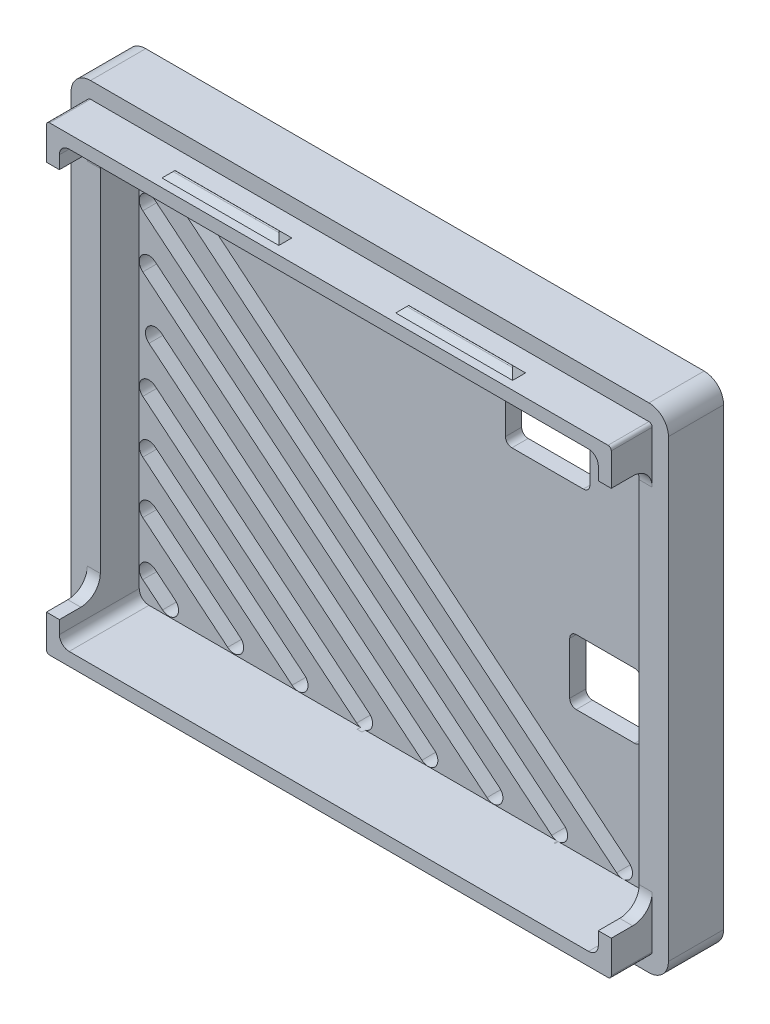
from build123d import *

# Parameters (mm, degrees)
EXTRUDE_1_DEPTH     = 2.5
EXTRUDE_6_DEPTH     = 6
EXTRUDE_7_DEPTH     = 12.3
SKETCH_7_W          = 20
SKETCH_7_H          = 4
EXTRUDE_8_DEPTH     = 1
CHAMFER_12_SIZE     = 2
CHAMFER_13_SIZE     = 2
FILLET_4_R          = 0.2
FILLET_5_R          = 0.2
MIRROR_START        = 8.886426593
MIRROR_1_OUTLINE_W  = 1
MIRROR_1_OUTLINE_H  = 4
MIRROR_1_DEPTH      = 20
MIRROR_START_2      = -26.113573407
MIRROR_1_2_DEPTH    = 18
MIRROR_START_3      = 11
MIRROR_1_3_DEPTH    = 3
CHAMFER_14_SIZE     = 2
FILLET_6_R          = 0.2
SKETCH_8_W          = 87
SKETCH_8_H          = 60
CUT_EXTRUDE_1_DEPTH = 6.3
FILLET_7_R          = 3
FILLET_8_R          = 3
FILLET_9_R          = 3
FILLET_10_R         = 3
CUT_EXTRUDE_2_DEPTH = 4
CUT_EXTRUDE_4_DEPTH = 6
CUT_EXTRUDE_5_DEPTH = 3


with BuildPart() as part:
    # 草图1 → 凸台-拉伸1 (new body)
    with BuildSketch(Plane.XY):
        with BuildLine():
            Line((-42.113573407, 33.400277008), (43.886426593, 33.400277008))
            ThreePointArc((43.886426593, 33.400277008), (46.007746936, 32.521597352), (46.886426593, 30.400277008))
            Line((46.886426593, 30.400277008), (46.886426593, -39.599722992))
            ThreePointArc((46.886426593, -39.599722992), (46.007746936, -41.721043335), (43.886426593, -42.599722992))
            Line((43.886426593, -42.599722992), (-42.113573407, -42.599722992))
            ThreePointArc((-42.113573407, -42.599722992), (-44.234893751, -41.721043335), (-45.113573407, -39.599722992))
            Line((-45.113573407, -39.599722992), (-45.113573407, 30.400277008))
            ThreePointArc((-45.113573407, 30.400277008), (-44.234893751, 32.521597352), (-42.113573407, 33.400277008))
        make_face()
    extrude(amount=EXTRUDE_1_DEPTH)

    # 草图2 → 凸台-拉伸6 (add)
    with BuildSketch(Plane.XY.offset(2.5)):
        with BuildLine():
            Line((-42.113573407, -42.599722992), (43.886426593, -42.599722992))
            ThreePointArc((43.886426593, -42.599722992), (46.007746936, -41.721043335), (46.886426593, -39.599722992))
            Line((46.886426593, -39.599722992), (46.886426593, 30.400277008))
            ThreePointArc((46.886426593, 30.400277008), (46.007746936, 32.521597352), (43.886426593, 33.400277008))
            Line((43.886426593, 33.400277008), (-42.113573407, 33.400277008))
            ThreePointArc((-42.113573407, 33.400277008), (-44.234893751, 32.521597352), (-45.113573407, 30.400277008))
            Line((-45.113573407, 30.400277008), (-45.113573407, -39.599722992))
            ThreePointArc((-45.113573407, -39.599722992), (-44.234893751, -41.721043335), (-42.113573407, -42.599722992))
        make_face()
        with BuildLine():
            Line((43.886426593, 30.900277008), (-42.113573407, 30.900277008))
            ThreePointArc((-42.113573407, 30.900277008), (-42.467126798, 30.753830399), (-42.613573407, 30.400277008))
            Line((-42.613573407, 30.400277008), (-42.613573407, -39.599722992))
            ThreePointArc((-42.613573407, -39.599722992), (-42.467126798, -39.953276382), (-42.113573407, -40.099722992))
            Line((-42.113573407, -40.099722992), (43.886426593, -40.099722992))
            ThreePointArc((43.886426593, -40.099722992), (44.239979983, -39.953276382), (44.386426593, -39.599722992))
            Line((44.386426593, -39.599722992), (44.386426593, 30.400277008))
            ThreePointArc((44.386426593, 30.400277008), (44.239979983, 30.753830399), (43.886426593, 30.900277008))
        make_face(mode=Mode.SUBTRACT)
    extrude(amount=EXTRUDE_6_DEPTH)

    # 草图6 → 凸台-拉伸7 (add)
    with BuildSketch(Plane.XY.offset(2.5)):
        with BuildLine():
            Line((44.386426593, -39.599722992), (44.386426593, 30.400277008))
            ThreePointArc((44.386426593, 30.400277008), (44.239979983, 30.753830399), (43.886426593, 30.900277008))
            Line((43.886426593, 30.900277008), (-42.113573407, 30.900277008))
            ThreePointArc((-42.113573407, 30.900277008), (-42.467126798, 30.753830399), (-42.613573407, 30.400277008))
            Line((-42.613573407, 30.400277008), (-42.613573407, -39.599722992))
            ThreePointArc((-42.613573407, -39.599722992), (-42.467126798, -39.953276382), (-42.113573407, -40.099722992))
            Line((-42.113573407, -40.099722992), (43.886426593, -40.099722992))
            ThreePointArc((43.886426593, -40.099722992), (44.239979983, -39.953276382), (44.386426593, -39.599722992))
        make_face()
        with BuildLine():
            Line((-40.613573407, 27.400277008), (-40.613573407, -36.599722992))
            ThreePointArc((-40.613573407, -36.599722992), (-40.174233579, -37.660383163), (-39.113573407, -38.099722992))
            Line((-39.113573407, -38.099722992), (40.886426593, -38.099722992))
            ThreePointArc((40.886426593, -38.099722992), (41.947086765, -37.660383163), (42.386426593, -36.599722992))
            Line((42.386426593, -36.599722992), (42.386426593, 27.400277008))
            ThreePointArc((42.386426593, 27.400277008), (41.947086765, 28.46093718), (40.886426593, 28.900277008))
            Line((40.886426593, 28.900277008), (-39.113573407, 28.900277008))
            ThreePointArc((-39.113573407, 28.900277008), (-40.174233579, 28.46093718), (-40.613573407, 27.400277008))
        make_face(mode=Mode.SUBTRACT)
    extrude(amount=EXTRUDE_7_DEPTH)

    # 草图7 → 凸台-拉伸8 (add)
    with BuildSketch(Plane.XZ.offset(40.099722992)):
        with Locations((-17.113573407, 12.5)):
            Rectangle(SKETCH_7_W, SKETCH_7_H)
        with Locations((18.886426593, 12.5)):
            Rectangle(SKETCH_7_W, SKETCH_7_H)
    extrude(amount=EXTRUDE_8_DEPTH)

    # 倒角12
    # the kernel refuses this chamfer: 2 mm, written as the material it takes off along each edge
    with BuildSketch(Plane(origin=(-32.256939383, -41.099722992, 14.5), x_dir=(0, 1, 0), z_dir=(1, 0, 0))) as chamfer_12_piece_1_section:
        Polygon((CHAMFER_12_SIZE, 0), (0, -CHAMFER_12_SIZE), (0, 0), align=None)
    chamfer_12_piece_1 = extrude(amount=30.286731952, mode=Mode.PRIVATE)
    chamfer_12_piece_1 = split(chamfer_12_piece_1, bisect_by=Plane(origin=(-32.256939383, -40.099722992, 14.5), z_dir=(0, -1, 0)), keep=Keep.TOP, mode=Mode.PRIVATE)
    add(chamfer_12_piece_1, mode=Mode.SUBTRACT)
    with BuildSketch(Plane(origin=(-7.113573407, -41.099722992, 19.643365976), x_dir=(0, 1, 0), z_dir=(0, 0, -1))) as chamfer_12_piece_2_section:
        Polygon((CHAMFER_12_SIZE, 0), (0, -CHAMFER_12_SIZE), (0, 0), align=None)
    chamfer_12_piece_2 = extrude(amount=9.143365976, mode=Mode.PRIVATE)
    chamfer_12_piece_2 = split(chamfer_12_piece_2, bisect_by=Plane(origin=(-7.113573407, -40.099722992, 19.643365976), z_dir=(0, -1, 0)), keep=Keep.TOP, mode=Mode.PRIVATE)
    add(chamfer_12_piece_2, mode=Mode.SUBTRACT)
    with BuildSketch(Plane(origin=(-1.970207431, -41.099722992, 10.5), x_dir=(0, 1, 0), z_dir=(-1, 0, 0))) as chamfer_12_piece_3_section:
        Polygon((CHAMFER_12_SIZE, 0), (0, -CHAMFER_12_SIZE), (0, 0), align=None)
    chamfer_12_piece_3 = extrude(amount=30.286731952, mode=Mode.PRIVATE)
    chamfer_12_piece_3 = split(chamfer_12_piece_3, bisect_by=Plane(origin=(-1.970207431, -40.099722992, 10.5), z_dir=(0, -1, 0)), keep=Keep.TOP, mode=Mode.PRIVATE)
    add(chamfer_12_piece_3, mode=Mode.SUBTRACT)
    with BuildSketch(Plane(origin=(-27.113573407, -41.099722992, 10.5), x_dir=(0, 1, 0), z_dir=(0, 0, 1))) as chamfer_12_piece_4_section:
        Polygon((CHAMFER_12_SIZE, 0), (0, -CHAMFER_12_SIZE), (0, 0), align=None)
    chamfer_12_piece_4 = extrude(amount=9.143365976, mode=Mode.PRIVATE)
    chamfer_12_piece_4 = split(chamfer_12_piece_4, bisect_by=Plane(origin=(-27.113573407, -40.099722992, 10.5), z_dir=(0, -1, 0)), keep=Keep.TOP, mode=Mode.PRIVATE)
    add(chamfer_12_piece_4, mode=Mode.SUBTRACT)

    # 倒角13
    # the kernel refuses this chamfer: 2 mm, written as the material it takes off along each edge
    with BuildSketch(Plane(origin=(3.743060617, -41.099722992, 14.5), x_dir=(0, 0, -1), z_dir=(1, 0, 0))) as chamfer_13_piece_1_section:
        Polygon((CHAMFER_13_SIZE, 0), (0, CHAMFER_13_SIZE), (0, 0), align=None)
    chamfer_13_piece_1 = extrude(amount=30.286731952, mode=Mode.PRIVATE)
    chamfer_13_piece_1 = split(chamfer_13_piece_1, bisect_by=Plane(origin=(3.743060617, -40.099722992, 14.5), z_dir=(0, -1, 0)), keep=Keep.TOP, mode=Mode.PRIVATE)
    add(chamfer_13_piece_1, mode=Mode.SUBTRACT)
    with BuildSketch(Plane(origin=(28.886426593, -41.099722992, 19.643365976), x_dir=(0, 1, 0), z_dir=(0, 0, -1))) as chamfer_13_piece_2_section:
        Polygon((CHAMFER_13_SIZE, 0), (0, -CHAMFER_13_SIZE), (0, 0), align=None)
    chamfer_13_piece_2 = extrude(amount=9.143365976, mode=Mode.PRIVATE)
    chamfer_13_piece_2 = split(chamfer_13_piece_2, bisect_by=Plane(origin=(28.886426593, -40.099722992, 19.643365976), z_dir=(0, -1, 0)), keep=Keep.TOP, mode=Mode.PRIVATE)
    add(chamfer_13_piece_2, mode=Mode.SUBTRACT)
    with BuildSketch(Plane(origin=(34.029792569, -41.099722992, 10.5), x_dir=(0, 0, 1), z_dir=(-1, 0, 0))) as chamfer_13_piece_3_section:
        Polygon((CHAMFER_13_SIZE, 0), (0, CHAMFER_13_SIZE), (0, 0), align=None)
    chamfer_13_piece_3 = extrude(amount=30.286731952, mode=Mode.PRIVATE)
    chamfer_13_piece_3 = split(chamfer_13_piece_3, bisect_by=Plane(origin=(34.029792569, -40.099722992, 10.5), z_dir=(0, -1, 0)), keep=Keep.TOP, mode=Mode.PRIVATE)
    add(chamfer_13_piece_3, mode=Mode.SUBTRACT)
    with BuildSketch(Plane(origin=(8.886426593, -41.099722992, 10.5), x_dir=(1, 0, 0), z_dir=(0, 0, 1))) as chamfer_13_piece_4_section:
        Polygon((CHAMFER_13_SIZE, 0), (0, CHAMFER_13_SIZE), (0, 0), align=None)
    chamfer_13_piece_4 = extrude(amount=9.143365976, mode=Mode.PRIVATE)
    chamfer_13_piece_4 = split(chamfer_13_piece_4, bisect_by=Plane(origin=(8.886426593, -40.099722992, 10.5), z_dir=(0, -1, 0)), keep=Keep.TOP, mode=Mode.PRIVATE)
    add(chamfer_13_piece_4, mode=Mode.SUBTRACT)

    # 圆角4
    fillet_4_edges = [part.edges().sort_by_distance(p)[0] for p in [
        (-17.113573407, -41.099722992, 12.5),
    ]]
    fillet(fillet_4_edges, radius=FILLET_4_R)

    # 圆角5
    fillet_5_edges = [part.edges().sort_by_distance(p)[0] for p in [
        (18.886426593, -41.099722992, 12.5),
    ]]
    fillet(fillet_5_edges, radius=FILLET_5_R)

    # 镜向1: read off the stored shape, not the designer's step
    # 镜向1 outline → 镜向1 (add)
    with BuildSketch(Plane.YZ.offset(MIRROR_START)):
        with Locations((31.400277008, 12.5)):
            Rectangle(MIRROR_1_OUTLINE_W, MIRROR_1_OUTLINE_H)
    extrude(amount=MIRROR_1_DEPTH)

    # Mirror 1 2 outline → Mirror 1 2 (add)
    with BuildSketch(Plane.YZ.offset(MIRROR_START_2)):
        with BuildLine():
            Line((31.758855652, 12.641421356), (30.900277008, 13.5))
            Line((30.900277008, 13.5), (30.900277008, 11.5))
            Line((30.900277008, 11.5), (31.758855652, 12.358578644))
            ThreePointArc((31.758855652, 12.358578644), (31.817434296, 12.5), (31.758855652, 12.641421356))
        make_face()
    extrude(amount=MIRROR_1_2_DEPTH)

    # Mirror 1 3 outline → Mirror 1 3 (cut)
    with BuildSketch(Plane.XY.offset(MIRROR_START_3)):
        Polygon((-26.113573407, 33), (-26.113573407, 30.900277008), (-25.19641612, 31.817434296), (-24.013850417, 33), align=None)
        Polygon((-8.113573407, 33), (-10.213296399, 33), (-8.113573407, 30.900277008), align=None)
    extrude(amount=MIRROR_1_3_DEPTH, mode=Mode.SUBTRACT)

    # 倒角14
    # the kernel refuses this chamfer: 2 mm, written as the material it takes off along each edge
    with BuildSketch(Plane(origin=(3.743060617, 31.900277008, 10.5), x_dir=(0, -1, 0), z_dir=(1, 0, 0))) as chamfer_14_piece_1_section:
        Polygon((CHAMFER_14_SIZE, 0), (0, -CHAMFER_14_SIZE), (0, 0), align=None)
    chamfer_14_piece_1 = extrude(amount=30.286731952, mode=Mode.PRIVATE)
    chamfer_14_piece_1 = split(chamfer_14_piece_1, bisect_by=Plane(origin=(3.743060617, 30.900277008, 10.5), z_dir=(0, 1, 0)), keep=Keep.TOP, mode=Mode.PRIVATE)
    add(chamfer_14_piece_1, mode=Mode.SUBTRACT)
    with BuildSketch(Plane(origin=(28.886426593, 31.900277008, 10.5), x_dir=(0, -1, 0), z_dir=(0, 0, 1))) as chamfer_14_piece_2_section:
        Polygon((CHAMFER_14_SIZE, 0), (0, -CHAMFER_14_SIZE), (0, 0), align=None)
    chamfer_14_piece_2 = extrude(amount=9.143365976, mode=Mode.PRIVATE)
    chamfer_14_piece_2 = split(chamfer_14_piece_2, bisect_by=Plane(origin=(28.886426593, 30.900277008, 10.5), z_dir=(0, 1, 0)), keep=Keep.TOP, mode=Mode.PRIVATE)
    add(chamfer_14_piece_2, mode=Mode.SUBTRACT)
    with BuildSketch(Plane(origin=(3.743060617, 31.900277008, 14.5), x_dir=(0, -1, 0), z_dir=(1, 0, 0))) as chamfer_14_piece_3_section:
        Polygon((CHAMFER_14_SIZE, 0), (0, CHAMFER_14_SIZE), (0, 0), align=None)
    chamfer_14_piece_3 = extrude(amount=30.286731952, mode=Mode.PRIVATE)
    chamfer_14_piece_3 = split(chamfer_14_piece_3, bisect_by=Plane(origin=(3.743060617, 30.900277008, 14.5), z_dir=(0, 1, 0)), keep=Keep.TOP, mode=Mode.PRIVATE)
    add(chamfer_14_piece_3, mode=Mode.SUBTRACT)
    with BuildSketch(Plane(origin=(8.886426593, 31.900277008, 10.5), x_dir=(0, -1, 0), z_dir=(0, 0, 1))) as chamfer_14_piece_4_section:
        Polygon((CHAMFER_14_SIZE, 0), (0, CHAMFER_14_SIZE), (0, 0), align=None)
    chamfer_14_piece_4 = extrude(amount=9.143365976, mode=Mode.PRIVATE)
    chamfer_14_piece_4 = split(chamfer_14_piece_4, bisect_by=Plane(origin=(8.886426593, 30.900277008, 10.5), z_dir=(0, 1, 0)), keep=Keep.TOP, mode=Mode.PRIVATE)
    add(chamfer_14_piece_4, mode=Mode.SUBTRACT)

    # 圆角6
    fillet_6_edges = [part.edges().sort_by_distance(p)[0] for p in [
        (18.886426593, 31.900277008, 12.5),
    ]]
    fillet(fillet_6_edges, radius=FILLET_6_R)

    # 草图8 → 切除-拉伸1 (cut)
    with BuildSketch(Plane.XY.offset(14.8)):
        with Locations((0.886426593, -4.599722992)):
            Rectangle(SKETCH_8_W, SKETCH_8_H)
    extrude(amount=-CUT_EXTRUDE_1_DEPTH, mode=Mode.SUBTRACT)

    # 圆角7
    fillet_7_edges = [part.edges().sort_by_distance(p)[0] for p in [
        (-41.613573407, 25.400277008, 8.5),
    ]]
    fillet(fillet_7_edges, radius=FILLET_7_R)

    # 圆角8
    fillet_8_edges = [part.edges().sort_by_distance(p)[0] for p in [
        (-41.613573407, -34.599722992, 8.5),
    ]]
    fillet(fillet_8_edges, radius=FILLET_8_R)

    # 圆角9
    fillet_9_edges = [part.edges().sort_by_distance(p)[0] for p in [
        (43.386426593, 25.400277008, 8.5),
    ]]
    fillet(fillet_9_edges, radius=FILLET_9_R)

    # 圆角10
    fillet_10_edges = [part.edges().sort_by_distance(p)[0] for p in [
        (43.386426593, -34.599722992, 8.5),
    ]]
    fillet(fillet_10_edges, radius=FILLET_10_R)

    # 草图9 → 切除-拉伸2 (cut)
    with BuildSketch(Plane(origin=(0, 0, 0), x_dir=(-1, 0, 0), z_dir=(0, 0, -1))):
        with BuildLine():
            Line((-35.686426593, -9.099722992), (-26.686426593, -9.099722992))
            ThreePointArc((-26.686426593, -9.099722992), (-25.979319812, -9.392616211), (-25.686426593, -10.099722992))
            Line((-25.686426593, -10.099722992), (-25.686426593, -18.099722992))
            ThreePointArc((-25.686426593, -18.099722992), (-25.979319812, -18.806829773), (-26.686426593, -19.099722992))
            Line((-26.686426593, -19.099722992), (-35.686426593, -19.099722992))
            ThreePointArc((-35.686426593, -19.099722992), (-36.393533374, -18.806829773), (-36.686426593, -18.099722992))
            Line((-36.686426593, -18.099722992), (-36.686426593, -10.099722992))
            ThreePointArc((-36.686426593, -10.099722992), (-36.393533374, -9.392616211), (-35.686426593, -9.099722992))
        make_face()
    extrude(amount=-CUT_EXTRUDE_2_DEPTH, mode=Mode.SUBTRACT)

    # 草图15 → 切除-拉伸4 (cut)
    with BuildSketch(Plane(origin=(0, 0, 0), x_dir=(-1, 0, 0), z_dir=(0, 0, -1))):
        with BuildLine():
            Line((-27.786426593, 23.860277008), (-16.786426593, 23.860277008))
            ThreePointArc((-16.786426593, 23.860277008), (-16.079319812, 23.567383789), (-15.786426593, 22.860277008))
            Line((-15.786426593, 22.860277008), (-15.786426593, 11.860277008))
            ThreePointArc((-15.786426593, 11.860277008), (-16.079319812, 11.153170227), (-16.786426593, 10.860277008))
            Line((-16.786426593, 10.860277008), (-27.786426593, 10.860277008))
            ThreePointArc((-27.786426593, 10.860277008), (-28.493533374, 11.153170227), (-28.786426593, 11.860277008))
            Line((-28.786426593, 11.860277008), (-28.786426593, 22.860277008))
            ThreePointArc((-28.786426593, 22.860277008), (-28.493533374, 23.567383789), (-27.786426593, 23.860277008))
        make_face()
    extrude(amount=-CUT_EXTRUDE_4_DEPTH, mode=Mode.SUBTRACT)

    # 草图16 → 切除-拉伸5 (cut)
    with BuildSketch(Plane(origin=(0, 0, 0), x_dir=(-1, 0, 0), z_dir=(0, 0, -1))):
        with BuildLine():
            Line((-34.813624229, -35.44135644), (38.160584986, 24.594541811))
            ThreePointArc((38.160584986, 24.594541811), (40.271939959, 24.389163681), (40.066561829, 22.277808707))
            Line((40.066561829, 22.277808707), (-32.907647386, -37.758089544))
            ThreePointArc((-32.907647386, -37.758089544), (-35.01900236, -37.552711413), (-34.813624229, -35.44135644))
        make_face()
        with BuildLine():
            Line((-24.812669862, -35.442516483), (38.160584986, 16.365594372))
            ThreePointArc((38.160584986, 16.365594372), (40.271939959, 16.160216241), (40.066561829, 14.048861268))
            Line((40.066561829, 14.048861268), (-22.906693019, -37.759249587))
            ThreePointArc((-22.906693019, -37.759249587), (-25.018047992, -37.553871456), (-24.812669862, -35.442516483))
        make_face()
        with BuildLine():
            Line((-14.847589681, -35.400071108), (38.160584986, 8.209766053))
            ThreePointArc((38.160584986, 8.209766053), (40.271939959, 8.004387922), (40.066561829, 5.893032949))
            Line((40.066561829, 5.893032949), (-12.941612838, -37.716804211))
            ThreePointArc((-12.941612838, -37.716804211), (-15.052967812, -37.511426081), (-14.847589681, -35.400071108))
        make_face()
        with BuildLine():
            Line((-4.829036756, -35.422622366), (37.207596564, -0.839074727))
            ThreePointArc((37.207596564, -0.839074727), (39.318951538, -1.044452857), (39.113573407, -3.155807831))
            Line((39.113573407, -3.155807831), (-2.923059913, -37.73935547))
            ThreePointArc((-2.923059913, -37.73935547), (-5.034414886, -37.533977339), (-4.829036756, -35.422622366))
        make_face()
        with BuildLine():
            Line((5.225028189, -35.488338825), (38.160584986, -8.392248878))
            ThreePointArc((38.160584986, -8.392248878), (40.271939959, -8.597627008), (40.066561829, -10.708981982))
            Line((40.066561829, -10.708981982), (7.131005032, -37.805071928))
            ThreePointArc((7.131005032, -37.805071928), (5.019650059, -37.599693798), (5.225028189, -35.488338825))
        make_face()
        with BuildLine():
            Line((15.163430095, -35.413465752), (38.160584986, -16.493701277))
            ThreePointArc((38.160584986, -16.493701277), (40.271939959, -16.699079408), (40.066561829, -18.810434381))
            Line((40.066561829, -18.810434381), (17.069406938, -37.730198855))
            ThreePointArc((17.069406938, -37.730198855), (14.958051965, -37.524820725), (15.163430095, -35.413465752))
        make_face()
        with BuildLine():
            Line((25.084557237, -35.317595037), (38.160584986, -24.559944081))
            ThreePointArc((38.160584986, -24.559944081), (40.271939959, -24.765322212), (40.066561829, -26.876677185))
            Line((40.066561829, -26.876677185), (26.99053408, -37.63432814))
            ThreePointArc((26.99053408, -37.63432814), (24.879179106, -37.42895001), (25.084557237, -35.317595037))
        make_face()
        with BuildLine():
            Line((35.108876828, -35.347155733), (38.160584986, -32.836514749))
            ThreePointArc((38.160584986, -32.836514749), (40.271939959, -33.041892879), (40.066561829, -35.153247853))
            Line((40.066561829, -35.153247853), (37.014853671, -37.663888837))
            ThreePointArc((37.014853671, -37.663888837), (34.903498698, -37.458510706), (35.108876828, -35.347155733))
        make_face()
    extrude(amount=-CUT_EXTRUDE_5_DEPTH, mode=Mode.SUBTRACT)


solid = part.part
